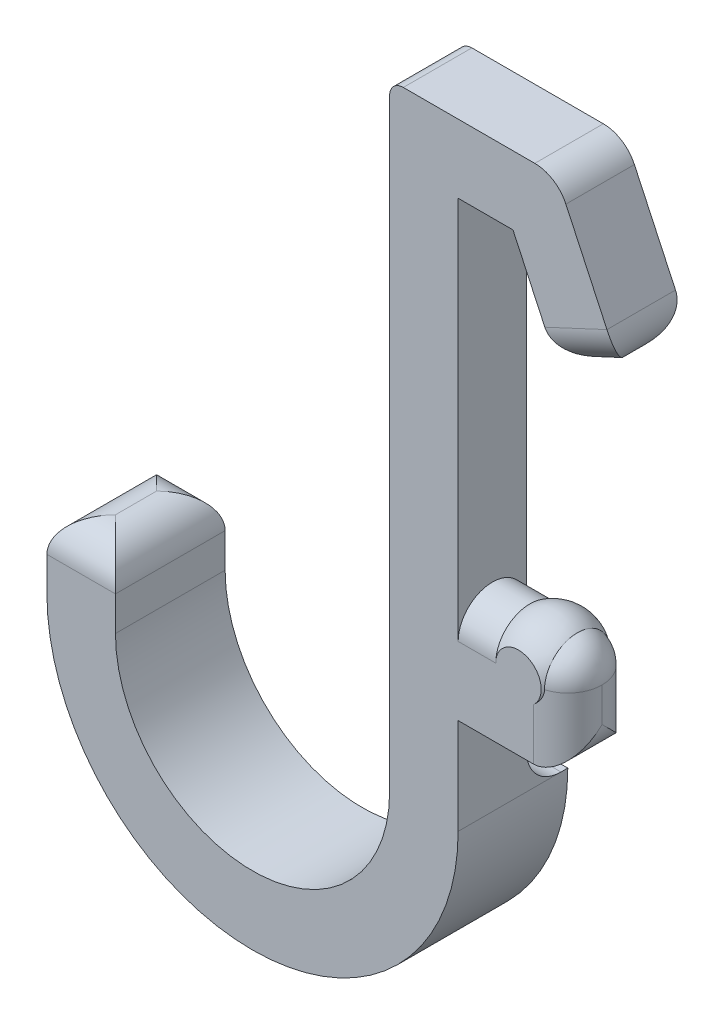
from build123d import *

# Parameters (mm, degrees)
EXTRUDE_1_DEPTH     = 5
FILLET_1_R          = 2.5
FILLET_2_R          = 1
EXTRUDE_2_DEPTH     = 8
FILLET_3_R          = 2.5
SKETCH_5_W          = 1.467751534
SKETCH_5_H          = 4.178210798
SKETCH_5_W_2        = 1.389566385
CUT_EXTRUDE_1_DEPTH = 20
EXTRUDE_START       = 3
EXTRUDE_3_DEPTH     = 3
FILLET_4_R          = 2.5


with BuildPart() as part:
    # 草图1 → 凸台-拉伸1 (new body)
    with BuildSketch(Plane.XY):
        with BuildLine():
            Line((0, 0), (0, 28))
            Line((0, 28), (4, 28))
            Line((4, 28), (7.380946094, 20.749537704))
            Line((7.380946094, 20.749537704), (11.912485029, 22.862629012))
            Line((11.912485029, 22.862629012), (7.185351304, 33))
            Line((7.185351304, 33), (-5, 33))
            Line((-5, 33), (-5, -12))
            ThreePointArc((-5, -12), (-15, -22), (-25, -12))
            Line((-25, -12), (-25, -7))
            Line((-25, -7), (-30, -7))
            Line((-30, -7), (-30, -12))
            ThreePointArc((-30, -12), (-15, -27), (0, -12))
            Line((0, -12), (0, -5))
            Line((0, -5), (8, -5))
            Line((8, -5), (8, 0))
            Line((8, 0), (0, 0))
        make_face()
    extrude(amount=EXTRUDE_1_DEPTH)

    # 圆角1
    fillet_1_edges = [part.edges().sort_by_distance(p)[0] for p in [
        (9.646715562, 21.806083358, 0),
        (9.646715562, 21.806083358, 5),
        (7.185351304, 33, 2.5),
        (11.912485029, 22.862629012, 2.5),
        (7.380946094, 20.749537704, 2.5),
    ]]
    fillet(fillet_1_edges, radius=FILLET_1_R - 0.0001)  # a hair under: the kernel refuses the full size

    # 圆角2
    fillet_2_edges = [part.edges().sort_by_distance(p)[0] for p in [
        (-5, 33, 2.5),
    ]]
    fillet(fillet_2_edges, radius=FILLET_2_R)

    # 草图3 → 凸台-拉伸2 (add)
    with BuildSketch(Plane(origin=(0, 0, 0), x_dir=(0, 0, -1), z_dir=(1, 0, 0))):
        with BuildLine():
            Line((-5, 0), (0, 0))
            ThreePointArc((0, 0), (-2.5, 2.5), (-5, 0))
        make_face()
    extrude(amount=EXTRUDE_2_DEPTH)

    # 圆角3
    fillet_3_edges = [part.edges().sort_by_distance(p)[0] for p in [
        (8, -2.5, 0),
        (8, -5, 2.5),
        (8, -2.5, 5),
        (8, 2.5, 2.5),
    ]]
    fillet(fillet_3_edges, radius=FILLET_3_R - 0.0001)  # a hair under: the kernel refuses the full size

    # 草图4 → 旋转3 (revolve)
    with BuildSketch(Plane(origin=(4.4, 0, 0), x_dir=(0, 0, -1), z_dir=(1, 0, 0))):
        with BuildLine():
            Line((-5.5, 0), (0.5, 0))
            ThreePointArc((0.5, 0), (-2.5, 3), (-5.5, 0))
        make_face()
    revolve(axis=Axis((4.4, 0, 2.5), (0, 0, -1)))

    # 草图5 → 切除-拉伸1 (cut)
    with BuildSketch(Plane.ZY.offset(5)):
        with Locations((-0.733875767, -0.010051234)):
            Rectangle(SKETCH_5_W, SKETCH_5_H)
        with Locations((5.694783193, -0.010051234)):
            Rectangle(SKETCH_5_W_2, SKETCH_5_H)
    extrude(amount=-CUT_EXTRUDE_1_DEPTH, mode=Mode.SUBTRACT)

    # 草图6 → 凸台-拉伸3 (add)
    with BuildSketch(Plane(origin=(0, 0, 0), x_dir=(-1, 0, 0), z_dir=(0, 0, -1)).offset(EXTRUDE_START)):
        with BuildLine():
            Line((25, -7), (30, -7))
            Line((30, -7), (30, -12))
            ThreePointArc((30, -12), (15, -27), (0, -12))
            Line((0, -12), (5, -12))
            ThreePointArc((5, -12), (15, -22), (25, -12))
            Line((25, -12), (25, -7))
        make_face()
    extrude(amount=-EXTRUDE_3_DEPTH)

    # 圆角4
    fillet_4_edges = [part.edges().sort_by_distance(p)[0] for p in [
        (-2.5, -12, 0),
        (-27.5, -7, -3),
        (-30, -7, 1),
        (-25, -7, 1),
        (-27.5, -7, 5),
    ]]
    fillet(fillet_4_edges, radius=FILLET_4_R - 0.0001)  # a hair under: the kernel refuses the full size


solid = part.part
